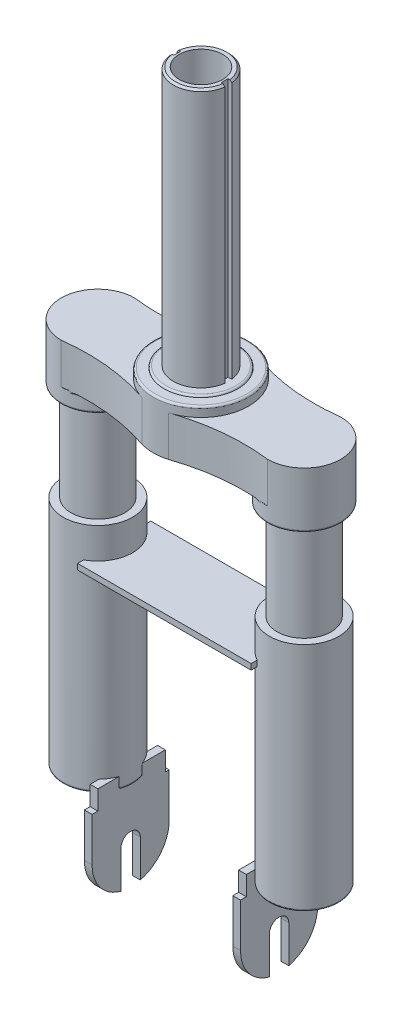
from build123d import *
from build123d.topology import SkipClean

# Parameters (mm, degrees)
SKETCH2_R            = 14.3
SKETCH2_R_2          = 11.3
BOSS_EXTRUDE1_DEPTH  = 140
SKETCH3_R            = 17.2
BOSS_EXTRUDE4_DEPTH  = 21
SKETCH7_R            = 24.75
BOSS_EXTRUDE5_DEPTH  = 5
FILLET3_R            = 1
BOSS_EXTRUDE6_START  = 0.9
SKETCH8_R            = 19.15
SKETCH8_R_2          = 14.3
BOSS_EXTRUDE6_DEPTH  = 0.9
FILLET4_R            = 1
SKETCH9_R            = 19
BOSS_EXTRUDE7_DEPTH  = 8.00642219
FILLET5_R            = 1
CHAMFER1_SIZE        = 1
SKETCH10_R           = 14
BOSS_EXTRUDE8_DEPTH  = 51.00642219
FILLET7_R            = 1
SKETCH11_R           = 18
BOSS_EXTRUDE9_DEPTH  = 120
FILLET8_R            = 1
BOSS_EXTRUDE14_DEPTH = 4
SKETCH20_W           = 90
SKETCH20_H           = 3
BOSS_EXTRUDE15_DEPTH = 19
CUT_EXTRUDE1_DEPTH   = 2


with BuildPart() as part:
    # Sketch2 → Boss-Extrude1 (new body)
    with BuildSketch(Plane(origin=(0, 0, 0), x_dir=(1, 0, 0), z_dir=(0, 1, 0))):
        with Locations(Location((0, 0, 0), (0, 0, 270))):
            Circle(SKETCH2_R)
        with Locations(Location((0, 0, 0), (0, 0, 270))):
            Circle(SKETCH2_R_2, mode=Mode.SUBTRACT)
    extrude(amount=-BOSS_EXTRUDE1_DEPTH)



with BuildPart() as body_2:
    # Sketch3 → Boss-Extrude4 (new body)
    with BuildSketch(Plane.XZ.offset(140)):
        with BuildLine():
            ThreePointArc((8.728222475, -23.159892755), (28.862466012, -18.820678576), (49.457396096, -18.564949601))
            ThreePointArc((49.457396096, -18.564949601), (51.480840164, -18.762569688), (53.5, -19))
            ThreePointArc((53.5, -19), (72.5, 0), (53.5, 19))
            ThreePointArc((53.5, 19), (51.480840164, 18.762569688), (49.457396096, 18.564949601))
            ThreePointArc((49.457396096, 18.564949601), (28.862466012, 18.820678576), (8.728222475, 23.159892755))
            ThreePointArc((8.728222475, 23.159892755), (7.81378272, 23.459739176), (6.902177911, 23.768097107))
            ThreePointArc((6.902177911, 23.768097107), (0, 24.75), (-6.902177911, 23.768097107))
            ThreePointArc((-6.902177911, 23.768097107), (-7.81378272, 23.459739176), (-8.728222475, 23.159892755))
            ThreePointArc((-8.728222475, 23.159892755), (-28.862466012, 18.820678576), (-49.457396096, 18.564949601))
            ThreePointArc((-49.457396096, 18.564949601), (-51.480840164, 18.762569688), (-53.5, 19))
            ThreePointArc((-53.5, 19), (-72.5, 0), (-53.5, -19))
            ThreePointArc((-53.5, -19), (-51.480840164, -18.762569688), (-49.457396096, -18.564949601))
            ThreePointArc((-49.457396096, -18.564949601), (-28.862466012, -18.820678576), (-8.728222475, -23.159892755))
            ThreePointArc((-8.728222475, -23.159892755), (-7.81378272, -23.459739176), (-6.902177911, -23.768097107))
            ThreePointArc((-6.902177911, -23.768097107), (0, -24.75), (6.902177911, -23.768097107))
            ThreePointArc((6.902177911, -23.768097107), (7.81378272, -23.459739176), (8.728222475, -23.159892755))
        make_face()
        with Locations(Location((0, 0, 0), (0, 0, 90))):
            Circle(SKETCH3_R, mode=Mode.SUBTRACT)
    extrude(amount=BOSS_EXTRUDE4_DEPTH)


with BuildPart() as part_1:
    with SkipClean():  # the faces are left unmerged after this step: merging them gives an invalid solid
        add(part.part)

        add(body_2.part)  # Boss-Extrude5 merges body 2
        # Sketch7 → Boss-Extrude5 (add)
        with BuildSketch(Plane(origin=(0, -140, 0), x_dir=(1, 0, 0), z_dir=(0, 1, 0))):
            with Locations(Location((0, 0, 0), (0, 0, 73.806875111))):
                Circle(SKETCH7_R)
        extrude(amount=BOSS_EXTRUDE5_DEPTH)

    # Fillet3
    fillet3_edges = [part_1.edges().sort_by_distance(p)[0] for p in [
        (-6.902177911, -135, 23.768097107),
    ]]
    fillet(fillet3_edges, radius=FILLET3_R)

    # Sketch8 → Boss-Extrude6 (add)
    with SkipClean():  # the faces are left unmerged after this step: merging them gives an invalid solid
        with BuildSketch(Plane(origin=(0, -135, 0), x_dir=(1, 0, 0), z_dir=(0, 1, 0)).offset(BOSS_EXTRUDE6_START)):
            with Locations(Location((0, 0, 0), (0, 0, 270))):
                Circle(SKETCH8_R)
            with Locations(Location((0, 0, 0), (0, 0, 270))):
                Circle(SKETCH8_R_2, mode=Mode.SUBTRACT)
        extrude(amount=-BOSS_EXTRUDE6_DEPTH)

    # Fillet4
    # the kernel refuses this fillet: 1 mm, written as the material it takes off along each edge
    with BuildSketch(Plane(origin=(0, -134.1, 0), x_dir=(0, 0, 1), z_dir=(-1, 0, 0))) as fillet4_piece_1:
        with BuildLine():
            CenterArc((18.155012563, -1), FILLET4_R, 5.739170477, 84.260829523)
            Line((18.155012563, 0), (18.155012563, 0.02))
            Line((18.155012563, 0.02), (19.15, 0.02))
            Line((19.15, 0.02), (19.17, 0))
            ThreePointArc((19.17, 0), (19.17, -0.45), (19.169899749, -0.898))
            Line((19.169899749, -0.898), (19.15, -0.9))
        make_face()
    revolve(axis=Axis((0, -134.1, 0), (0, 1, 0)), mode=Mode.SUBTRACT)

    # Sketch9 → Boss-Extrude7 (add)
    with SkipClean():  # the faces are left unmerged after this step: merging them gives an invalid solid
        with BuildSketch(Plane.XZ.offset(161)):
            with Locations(Location((-53.5, 0, 0), (0, 0, 270))):
                Circle(SKETCH9_R)
            with Locations(Location((53.5, 0, 0), (0, 0, 90))):
                Circle(SKETCH9_R)
        extrude(amount=BOSS_EXTRUDE7_DEPTH)

    # Fillet5
    # the kernel refuses this fillet: 1 mm, written as the material it adds along each edge
    with BuildSketch(Plane(origin=(-53.5, -161, 0), x_dir=(0.08257677749843437, 0, -0.9965847057917225), z_dir=(-0.9965847057917225, 0, -0.08257677749843437))) as fillet5_piece_1_section:
        with BuildLine():
            CenterArc((19 + FILLET5_R, FILLET5_R), FILLET5_R, 180, 90)
            Line((19, FILLET5_R), (19, 0))
            Line((19, 0), (19 + FILLET5_R, 0))
        make_face()
    fillet5_piece_1 = revolve(axis=Axis((-53.5, -161, 0), (0, -1, 0)), revolution_arc=170.526611066, mode=Mode.PRIVATE)
    fillet5_piece_1 = fillet5_piece_1 - Plane(origin=(-40.435266864, -161.27732676, -121.400971601), x_dir=(-0.12655819396211102, 0, 0.9919591844128712), z_dir=(0, 1, 0)) * Cylinder(103.231033302, 81, mode=Mode.PRIVATE)
    fillet5_piece_1 = fillet5_piece_1 - Plane(origin=(-40.435266864, -161.27732676, 121.400971601), x_dir=(0.32483535115732903, 0, -0.9457705824556476), z_dir=(0, 1, 0)) * Cylinder(103.231033302, 81, mode=Mode.PRIVATE)
    add(fillet5_piece_1)
    with BuildSketch(Plane(origin=(53.5, -161, 0), x_dir=(-0.08257677751286734, 0, 0.9965847057905265), z_dir=(0.9965847057905265, 0, 0.08257677751286734))) as fillet5_piece_2_section:
        with BuildLine():
            CenterArc((19 + FILLET5_R, FILLET5_R), FILLET5_R, 180, 90)
            Line((19, FILLET5_R), (19, 0))
            Line((19, 0), (19 + FILLET5_R, 0))
        make_face()
    fillet5_piece_2 = revolve(axis=Axis((53.5, -161, 0), (0, -1, 0)), revolution_arc=170.526611065, mode=Mode.PRIVATE)
    fillet5_piece_2 = fillet5_piece_2 - Plane(origin=(40.435266865, -161.27732676, -121.400971601), x_dir=(-0.3248353511573105, 0, 0.9457705824556539), z_dir=(0, 1, 0)) * Cylinder(103.231033303, 81, mode=Mode.PRIVATE)
    fillet5_piece_2 = fillet5_piece_2 - Plane(origin=(40.435266864, -161.27732676, 121.400971601), x_dir=(0.1265581939621054, 0, -0.991959184412872), z_dir=(0, 1, 0)) * Cylinder(103.231033302, 81, mode=Mode.PRIVATE)
    add(fillet5_piece_2)
    # the kernel refuses this fillet: 1 mm, written as the material it takes off along each edge
    with BuildSketch(Plane(origin=(-53.5, -169.00642219, 0), x_dir=(0, 0, -1), z_dir=(-1, 0, 0))) as fillet5_2_piece_1:
        with BuildLine():
            CenterArc((19 - FILLET5_R, -FILLET5_R), FILLET5_R, 0, 90)
            Line((19 - FILLET5_R, 0), (19, 0))
            Line((19, 0), (19, -FILLET5_R))
        make_face()
    revolve(axis=Axis((-53.5, -169.00642219, 0), (0, -1, 0)), mode=Mode.SUBTRACT)
    with BuildSketch(Plane(origin=(53.5, -169.00642219, 0), x_dir=(0, 0, 1), z_dir=(1, 0, 0))) as fillet5_2_piece_2:
        with BuildLine():
            CenterArc((19 - FILLET5_R, -FILLET5_R), FILLET5_R, 0, 90)
            Line((19 - FILLET5_R, 0), (19, 0))
            Line((19, 0), (19, -FILLET5_R))
        make_face()
    revolve(axis=Axis((53.5, -169.00642219, 0), (0, -1, 0)), mode=Mode.SUBTRACT)

    # Chamfer1
    chamfer1_edges = [part_1.edges().sort_by_distance(p)[0] for p in [
        (0, 0, -14.3),
    ]]
    chamfer(chamfer1_edges, length=CHAMFER1_SIZE)

    # Sketch10 → Boss-Extrude8 (add)
    with SkipClean():  # the faces are left unmerged after this step: merging them gives an invalid solid
        with BuildSketch(Plane.XZ.offset(169.00642219)):
            with Locations(Location((-53.5, 0, 0), (0, 0, 90))):
                Circle(SKETCH10_R)
            with Locations(Location((53.5, 0, 0), (0, 0, 90))):
                Circle(SKETCH10_R)
        extrude(amount=BOSS_EXTRUDE8_DEPTH)

    # Fillet7
    fillet7_edges = [part_1.edges().sort_by_distance(p)[0] for p in [
        (-53.5, -169.00642219, -14),
        (53.5, -169.00642219, -14),
    ]]
    fillet(fillet7_edges, radius=FILLET7_R)

    # Sketch11 → Boss-Extrude9 (add)
    with SkipClean():  # the faces are left unmerged after this step: merging them gives an invalid solid
        with BuildSketch(Plane.XZ.offset(220.01284438)):
            with Locations(Location((-53.5, 0, 0), (0, 0, 270))):
                Circle(SKETCH11_R)
            with Locations(Location((53.5, 0, 0), (0, 0, 90))):
                Circle(SKETCH11_R)
        extrude(amount=BOSS_EXTRUDE9_DEPTH)

    # Fillet8
    fillet8_edges = [part_1.edges().sort_by_distance(p)[0] for p in [
        (-53.5, -340.01284438, 18),
        (53.5, -340.01284438, -18),
    ]]
    fillet(fillet8_edges, radius=FILLET8_R)

    # Sketch13 → Boss-Extrude14 (add)
    with SkipClean():  # the faces are left unmerged after this step: merging them gives an invalid solid
        with BuildSketch(Plane(origin=(36.5, 0, 0), x_dir=(0, 0, -1), z_dir=(1, 0, 0))):
            with BuildLine():
                Line((-17, -334), (18, -334))
                Line((18, -334), (18, -344))
                Line((18, -344), (20, -344))
                Line((20, -344), (20, -366.64025827))
                ThreePointArc((20, -366.64025827), (15.817711592, -378.879539295), (5.02, -386.000000004))
                Line((5.02, -386.000000004), (5.02, -366.64025827))
                ThreePointArc((5.02, -366.64025827), (0, -361.62025827), (-5.02, -366.64025827))
                Line((-5.02, -366.64025827), (-5.02, -386.000000004))
                ThreePointArc((-5.02, -386.000000004), (-15.817711592, -378.879539295), (-20, -366.64025827))
                Line((-20, -366.64025827), (-20, -344))
                Line((-20, -344), (-17, -344))
                Line((-17, -344), (-17, -334))
            make_face()
        boss_extrude14 = extrude(amount=BOSS_EXTRUDE14_DEPTH)

    # Mirror4: Boss-Extrude14 across plane
    with SkipClean():  # the faces are left unmerged after this step: merging them gives an invalid solid
        add(boss_extrude14.mirror(Plane(origin=(0, 0, 0), x_dir=(0, 0, 1), z_dir=(1, 0, 0))))

    # Sketch20 → Boss-Extrude15 (add, symmetric)
    with SkipClean():  # the faces are left unmerged after this step: merging them gives an invalid solid
        with BuildSketch(Plane.XY):
            with Locations((0, -237.500000004)):
                Rectangle(SKETCH20_W, SKETCH20_H)
        extrude(amount=BOSS_EXTRUDE15_DEPTH, both=True)

    # Sketch21 → Cut-Extrude1 (cut)
    with SkipClean():  # the faces are left unmerged after this step: merging them gives an invalid solid
        with BuildSketch(Plane(origin=(14.3, 0, 0), x_dir=(0, 0, -1), z_dir=(1, 0, 0))):
            Polygon((-1.78467608, -134.1), (1.78467608, -134.1), (1.78467608, -1), (1.78467608, 0), (-1.78467608, 0), align=None)
        cut_extrude1 = extrude(amount=-CUT_EXTRUDE1_DEPTH, mode=Mode.SUBTRACT)

    # Mirror5: Cut-Extrude1 across plane
    with SkipClean():  # the faces are left unmerged after this step: merging them gives an invalid solid
        add(cut_extrude1.mirror(Plane(origin=(0, 0, 0), x_dir=(0, 0, 1), z_dir=(1, 0, 0))), mode=Mode.SUBTRACT)


solid = part_1.part
